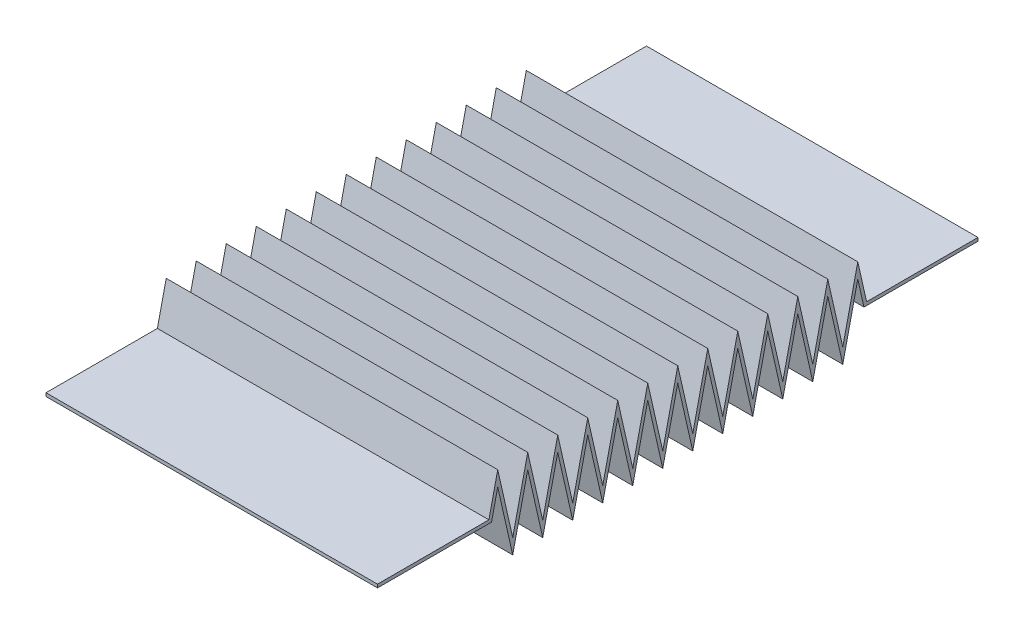
from build123d import *

# Parameters (mm, degrees)
EXTRUDE_THIN1_DEPTH = 25


with BuildPart() as part:
    # Sketch3 → Extrude-Thin1 (new, symmetric)
    with BuildSketch(Plane(origin=(0, 0, 0), x_dir=(0, 0, -1), z_dir=(1, 0, 0))):
        Polygon((0, 4.75), (17.199749676, 4.75), (18.131419444, 8.867260723), (20.394258332, -1.132739277), (22.657097221, 8.867260723), (24.919936109, -1.132739277), (27.182774997, 8.867260723), (29.445613886, -1.132739277), (31.708452774, 8.867260723), (33.971291662, -1.132739277), (36.23413055, 8.867260723), (38.496969439, -1.132739277), (40.759808327, 8.867260723), (43.022647215, -1.132739277), (45.285486103, 8.867260723), (47.548324992, -1.132739277), (49.81116388, 8.867260723), (52.074002768, -1.132739277), (54.336841657, 8.867260723), (56.599680545, -1.132739277), (58.862519433, 8.867260723), (61.125358321, -1.132739277), (63.38819721, 8.867260723), (65.651036098, -1.132739277), (67.913874986, 8.867260723), (70.176713875, -1.132739277), (72.439552763, 8.867260723), (73.371222531, 4.75), (90.570972207, 4.75), (90.570972207, 5.25), (73.770721883, 5.25), (72.439552763, 11.132739277), (70.176713875, 1.132739277), (67.913874986, 11.132739277), (65.651036098, 1.132739277), (63.38819721, 11.132739277), (61.125358321, 1.132739277), (58.862519433, 11.132739277), (56.599680545, 1.132739277), (54.336841657, 11.132739277), (52.074002768, 1.132739277), (49.81116388, 11.132739277), (47.548324992, 1.132739277), (45.285486103, 11.132739277), (43.022647215, 1.132739277), (40.759808327, 11.132739277), (38.496969439, 1.132739277), (36.23413055, 11.132739277), (33.971291662, 1.132739277), (31.708452774, 11.132739277), (29.445613886, 1.132739277), (27.182774997, 11.132739277), (24.919936109, 1.132739277), (22.657097221, 11.132739277), (20.394258332, 1.132739277), (18.131419444, 11.132739277), (16.800250324, 5.25), (0, 5.25), align=None)
    extrude(amount=EXTRUDE_THIN1_DEPTH, both=True)


solid = part.part
